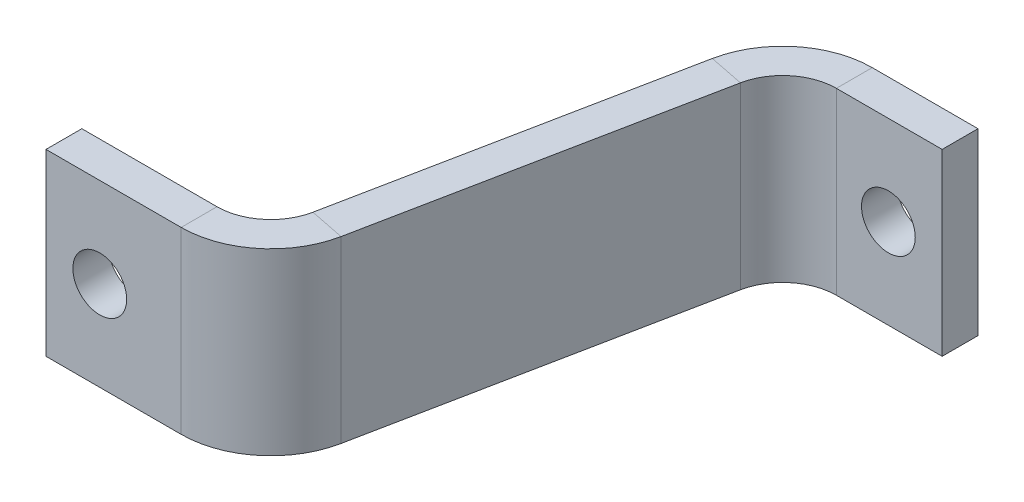
from build123d import *

# Parameters (mm, degrees)
SM_BASE_FLANGE_1_DEPTH = 10
SKETCH_9_R             = 1.5
CUT_EXTRUDE_1_DEPTH    = 10
SKETCH_10_R            = 1.5
CUT_EXTRUDE_2_DEPTH    = 10


# Sheet-metal steps are written as plain solids
with BuildPart() as part:
    # 草图4 → 基体-法兰1 (new body)
    with BuildSketch(Plane(origin=(0, 0, 0), x_dir=(1, 0, 0), z_dir=(0, 1, 0))):
        with BuildLine():
            Line((-57.778209212, -22.439021502), (-50.237620921, -22.439021502))
            ThreePointArc((-50.237620921, -22.439021502), (-48.335654204, -21.759047926), (-47.295878894, -20.027369908))
            Line((-47.295878894, -20.027369908), (-43.582093077, -1.458440827))
            ThreePointArc((-43.582093077, -1.458440827), (-41.849134227, 1.427689204), (-38.679189699, 2.560978498))
            Line((-38.679189699, 2.560978498), (-32.778209212, 2.560978498))
            Line((-32.778209212, 2.560978498), (-32.778209212, 0.560978498))
            Line((-32.778209212, 0.560978498), (-38.679189699, 0.560978498))
            ThreePointArc((-38.679189699, 0.560978498), (-40.581156416, -0.118995078), (-41.620931726, -1.850673097))
            Line((-41.620931726, -1.850673097), (-45.334717542, -20.419602178))
            ThreePointArc((-45.334717542, -20.419602178), (-47.067676393, -23.305732209), (-50.237620921, -24.439021502))
            Line((-50.237620921, -24.439021502), (-57.778209212, -24.439021502))
            Line((-57.778209212, -24.439021502), (-57.778209212, -22.439021502))
        make_face()
    extrude(amount=SM_BASE_FLANGE_1_DEPTH)

    # 草图9 → 切除-拉伸1 (cut)
    with BuildSketch(Plane(origin=(0, 0, 22.439021502), x_dir=(-1, 0, 0), z_dir=(0, 0, -1))):
        with Locations((54.778209212, 5)):
            Circle(SKETCH_9_R)
    extrude(amount=-CUT_EXTRUDE_1_DEPTH, mode=Mode.SUBTRACT)

    # 草图10 → 切除-拉伸2 (cut)
    with BuildSketch(Plane.XY.offset(-0.560978498)):
        with Locations((-35.778209212, 5)):
            Circle(SKETCH_10_R)
    extrude(amount=-CUT_EXTRUDE_2_DEPTH, mode=Mode.SUBTRACT)


solid = part.part
